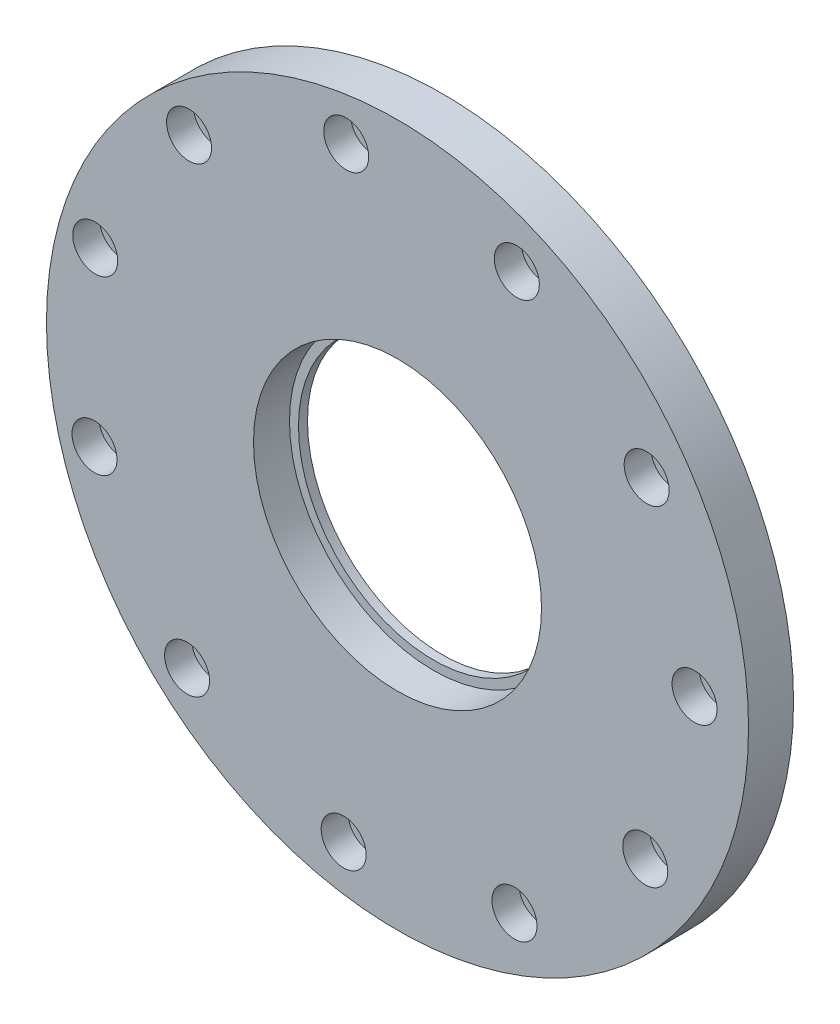
from build123d import *
from build123d.topology import SkipClean

# Parameters (mm, degrees)
SKETCH1_R           = 39
SKETCH1_R_2         = 2.5
SKETCH1_R_3         = 16
BOSS_EXTRUDE1_DEPTH = 3
BOSS_EXTRUDE2_START = 2
SKETCH2_R           = 39
SKETCH2_R_2         = 16
BOSS_EXTRUDE2_DEPTH = 2
SKETCH3_R           = 1.6
CUT_EXTRUDE1_DEPTH  = 56.380501984
SKETCH4_R           = 16
SKETCH4_R_2         = 15
BOSS_EXTRUDE3_DEPTH = 1


with BuildPart() as part:
    # Sketch1 → Boss-Extrude1 (new body)
    with BuildSketch(Plane.XY):
        Circle(SKETCH1_R)
        with Locations((33, 0)):
            Circle(SKETCH1_R_2, mode=Mode.SUBTRACT)
        with Locations((27.524887702, -18.358963497)):
            Circle(SKETCH1_R_2, mode=Mode.SUBTRACT)
        with Locations((12.993325106, -30.84343721)):
            Circle(SKETCH1_R_2, mode=Mode.SUBTRACT)
        with Locations((-5.98101934, -33.489688945)):
            Circle(SKETCH1_R_2, mode=Mode.SUBTRACT)
        with Locations((-23.373925339, -25.457552475)):
            Circle(SKETCH1_R_2, mode=Mode.SUBTRACT)
        with Locations((-33.663268129, -9.297174376)):
            Circle(SKETCH1_R_2, mode=Mode.SUBTRACT)
        with Locations((-33.582254077, 9.860639489)):
            Circle(SKETCH1_R_2, mode=Mode.SUBTRACT)
        with Locations((-23.15660457, 25.933418581)):
            Circle(SKETCH1_R_2, mode=Mode.SUBTRACT)
        with Locations((-5.696389663, 33.818169103)):
            Circle(SKETCH1_R_2, mode=Mode.SUBTRACT)
        with Locations((13.254895779, 31.011538474)):
            Circle(SKETCH1_R_2, mode=Mode.SUBTRACT)
        with Locations((27.680352531, 18.40461209)):
            Circle(SKETCH1_R_2, mode=Mode.SUBTRACT)
        Circle(SKETCH1_R_3, mode=Mode.SUBTRACT)
    extrude(amount=BOSS_EXTRUDE1_DEPTH)

    # Sketch2 → Boss-Extrude2 (add)
    with BuildSketch(Plane(origin=(0, 0, 0), x_dir=(-1, 0, 0), z_dir=(0, 0, -1)).offset(BOSS_EXTRUDE2_START)):
        Circle(SKETCH2_R)
        Circle(SKETCH2_R_2, mode=Mode.SUBTRACT)
    extrude(amount=-BOSS_EXTRUDE2_DEPTH)

    # Sketch3 → Cut-Extrude1 (cut, through all)
    with BuildSketch(Plane.XY.offset(3)):
        with Locations((33, 0)):
            Circle(SKETCH3_R)
        with Locations((27.524887702, -18.358963497)):
            Circle(SKETCH3_R)
        with Locations((12.993325106, -30.84343721)):
            Circle(SKETCH3_R)
        with Locations((-5.98101934, -33.489688945)):
            Circle(SKETCH3_R)
        with Locations((-23.373925339, -25.457552475)):
            Circle(SKETCH3_R)
        with Locations((-33.663268129, -9.297174376)):
            Circle(SKETCH3_R)
        with Locations((-33.582254077, 9.860639489)):
            Circle(SKETCH3_R)
        with Locations((-23.15660457, 25.933418581)):
            Circle(SKETCH3_R)
        with Locations((-5.696389663, 33.818169103)):
            Circle(SKETCH3_R)
        with Locations((13.254895779, 31.011538474)):
            Circle(SKETCH3_R)
        with Locations((27.680352531, 18.40461209)):
            Circle(SKETCH3_R)
    extrude(amount=-CUT_EXTRUDE1_DEPTH, mode=Mode.SUBTRACT)

    # Sketch4 → Boss-Extrude3 (add)
    with SkipClean():  # the faces are left unmerged after this step: merging them gives an invalid solid
        with BuildSketch(Plane(origin=(0, 0, -2), x_dir=(-1, 0, 0), z_dir=(0, 0, -1))):
            Circle(SKETCH4_R)
            Circle(SKETCH4_R_2, mode=Mode.SUBTRACT)
        extrude(amount=-BOSS_EXTRUDE3_DEPTH)


solid = part.part
